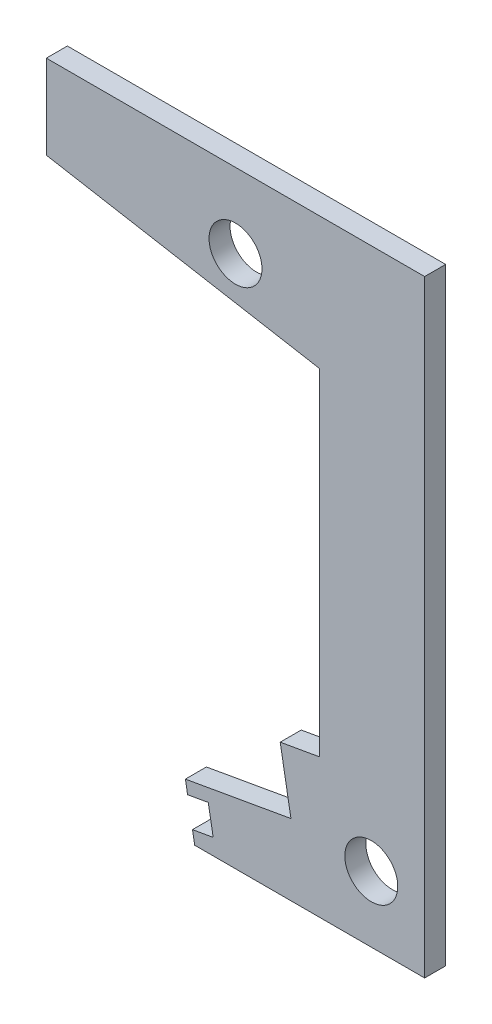
from build123d import *

# Parameters (mm, degrees)
ESQUISSE1_R             = 6.3
BOSS_EXTRU_1_DEPTH      = 5
ENL_V_MAT_EXTRU_1_DEPTH = 5


with BuildPart() as part:
    # Esquisse1 → Boss.-Extru.1 (new body)
    with BuildSketch(Plane.XY):
        Polygon((-65, 51.461253746), (0, 40), (0, -40), (-9.359100785, -41.650261983), (-6.809077296, -56.112163836), (-31.918247866, -60.539588071), (-29.710027076, -73.063030491), (25, -73.063030491), (25, 71.461253746), (-65, 71.461253746), align=None)
        with Locations((-20, 53.680805733)):
            Circle(ESQUISSE1_R, mode=Mode.SUBTRACT)
        with Locations((12.311279523, -57.398341828)):
            Circle(ESQUISSE1_R, mode=Mode.SUBTRACT)
    extrude(amount=BOSS_EXTRU_1_DEPTH)

    # Esquisse2 → Enlèv. mat.-Extru.1 (cut)
    with BuildSketch(Plane(origin=(0, 0, 0), x_dir=(-1, 0, 0), z_dir=(0, 0, -1))):
        Polygon((31.396602506, -63.497985917), (30.230971609, -70.108607232), (25.306932844, -69.240366344), (26.472563741, -62.629745029), align=None)
    extrude(amount=-ENL_V_MAT_EXTRU_1_DEPTH, mode=Mode.SUBTRACT)


solid = part.part
